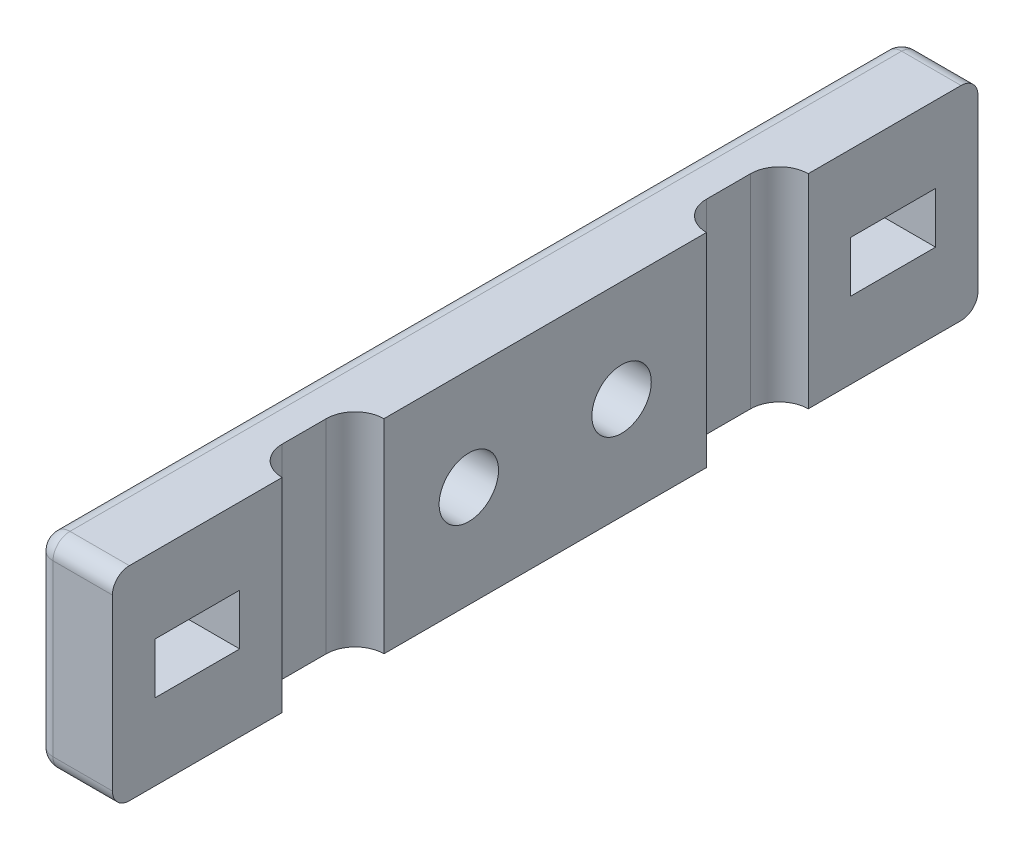
from build123d import *

# Parameters (mm, degrees)
BASE_DEPTH                 = 12
SCREWS_ZIP_TIE_HOLES_REACH = 30.539
SKETCH2_R                  = 1.75
SKETCH2_W                  = 5
SKETCH2_H                  = 3
F_1MM_EDGE_FILLETS_R       = 1


with BuildPart() as part:
    # Sketch1 → Base (new body)
    with BuildSketch(Plane(origin=(0, 0, 0), x_dir=(1, 0, 0), z_dir=(0, 1, 0))):
        with BuildLine():
            Line((4.5, 25.5), (4.5, 15.5))
            ThreePointArc((4.5, 15.5), (3.297918472, 15.002081528), (2.8, 13.8))
            Line((2.8, 13.8), (2.8, 11.2))
            ThreePointArc((2.8, 11.2), (3.297918472, 9.997918472), (4.5, 9.5))
            Line((4.5, 9.5), (4.5, -9.5))
            ThreePointArc((4.5, -9.5), (3.297918472, -9.997918472), (2.8, -11.2))
            Line((2.8, -11.2), (2.8, -13.8))
            ThreePointArc((2.8, -13.8), (3.297918472, -15.002081528), (4.5, -15.5))
            Line((4.5, -15.5), (4.5, -25.5))
            Line((4.5, -25.5), (0, -25.5))
            Line((0, -25.5), (0, 25.5))
            Line((0, 25.5), (4.5, 25.5))
        make_face()
    extrude(amount=BASE_DEPTH)

    # Sketch2 → Screws & Zip Tie Holes (cut, up to next)
    with BuildSketch(Plane(origin=(4.5, 0, 0), x_dir=(0, 0, -1), z_dir=(1, 0, 0)), mode=Mode.PRIVATE) as screws_zip_tie_holes_sk1:
        with Locations((-4.5, 6)):
            Circle(SKETCH2_R)
    screws_zip_tie_holes_tool1 = extrude(screws_zip_tie_holes_sk1.sketch, amount=-SCREWS_ZIP_TIE_HOLES_REACH, mode=Mode.PRIVATE) & part.part
    # Sketch2 → Screws & Zip Tie Holes (cut, up to next)
    with BuildSketch(Plane(origin=(4.5, 0, 0), x_dir=(0, 0, -1), z_dir=(1, 0, 0)), mode=Mode.PRIVATE) as screws_zip_tie_holes_sk2:
        with Locations((4.5, 6)):
            Circle(SKETCH2_R)
    screws_zip_tie_holes_tool2 = extrude(screws_zip_tie_holes_sk2.sketch, amount=-SCREWS_ZIP_TIE_HOLES_REACH, mode=Mode.PRIVATE) & part.part
    # Sketch2 → Screws & Zip Tie Holes (cut, up to next)
    with BuildSketch(Plane(origin=(4.5, 0, 0), x_dir=(0, 0, -1), z_dir=(1, 0, 0)), mode=Mode.PRIVATE) as screws_zip_tie_holes_sk3:
        with Locations((20.5, 6)):
            Rectangle(SKETCH2_W, SKETCH2_H)
    screws_zip_tie_holes_tool3 = extrude(screws_zip_tie_holes_sk3.sketch, amount=-SCREWS_ZIP_TIE_HOLES_REACH, mode=Mode.PRIVATE) & part.part
    # Sketch2 → Screws & Zip Tie Holes (cut, up to next)
    with BuildSketch(Plane(origin=(4.5, 0, 0), x_dir=(0, 0, -1), z_dir=(1, 0, 0)), mode=Mode.PRIVATE) as screws_zip_tie_holes_sk4:
        with Locations((-20.5, 6)):
            Rectangle(SKETCH2_W, SKETCH2_H)
    screws_zip_tie_holes_tool4 = extrude(screws_zip_tie_holes_sk4.sketch, amount=-SCREWS_ZIP_TIE_HOLES_REACH, mode=Mode.PRIVATE) & part.part
    add(screws_zip_tie_holes_tool1.solids().sort_by_distance((4.5, 6, 4.5))[0], mode=Mode.SUBTRACT)
    add(screws_zip_tie_holes_tool2.solids().sort_by_distance((4.5, 6, -4.5))[0], mode=Mode.SUBTRACT)
    add(screws_zip_tie_holes_tool3.solids().sort_by_distance((4.5, 6, -20.5))[0], mode=Mode.SUBTRACT)
    add(screws_zip_tie_holes_tool4.solids().sort_by_distance((4.5, 6, 20.5))[0], mode=Mode.SUBTRACT)

    # 1mm Edge Fillets
    f_1mm_edge_fillets_edges = [part.edges().sort_by_distance(p)[0] for p in [
        (2.25, 12, -25.5),
        (2.25, 0, -25.5),
        (2.25, 0, 25.5),
        (2.25, 12, 25.5),
        (0, 0, 0),
        (0, 6, 25.5),
        (0, 6, -25.5),
        (0, 12, 0),
    ]]
    fillet(f_1mm_edge_fillets_edges, radius=F_1MM_EDGE_FILLETS_R)


solid = part.part
